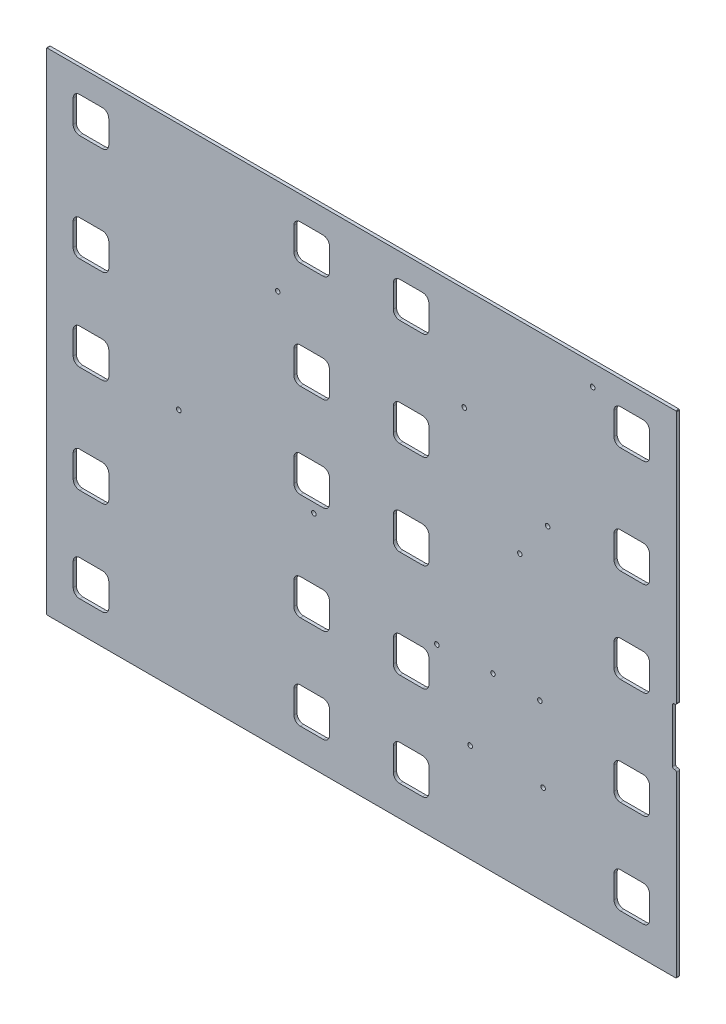
from build123d import *

# Parameters (mm, degrees)
BOSS_EXTRUDE2_DEPTH  = 3.175
CUT_EXTRUDE6_DEPTH   = 570.66370086
LPATTERN2_COUNT      = 2
LPATTERN2_PITCH      = 217.5764
MIRROR1_COPY_1_DEPTH = 570.66370086
CUT_EXTRUDE8_DEPTH   = 570.66370086
FILLET1_R            = 1.5875
M4_CLEARANCE_HOLE1_D = 4.5
FILLET2_R            = 0.79375


with BuildPart() as part:
    # Sketch9 → Boss-Extrude2 (new body)
    with BuildSketch(Plane.XY):
        with BuildLine():
            ThreePointArc((476.883185703, 172.362093322), (476.641026062, 172.560544591), (476.44252393, 172.80266254))
            Line((476.44252393, 172.80266254), (-143.934841652, 172.737505322))
            ThreePointArc((-143.934841652, 172.737505322), (-144.133292922, 172.495345682), (-144.375410871, 172.29684355))
            Line((-144.375410871, 172.29684355), (-144.324643337, -311.072922788))
            ThreePointArc((-144.324643337, -311.072922788), (-144.082483696, -311.271374057), (-143.883981564, -311.513492007))
            Line((-143.883981564, -311.513492007), (476.493384018, -311.448334789))
            ThreePointArc((476.493384018, -311.448334789), (476.691835287, -311.206175148), (476.933953237, -311.007673016))
            Line((476.933953237, -311.007673016), (476.883185703, 172.362093322))
        make_face()
    extrude(amount=BOSS_EXTRUDE2_DEPTH)

    # Sketch10 → Cut-Extrude6 (cut, through all)
    with BuildSketch(Plane.XY.offset(3.175)):
        with BuildLine():
            ThreePointArc((-111.536959772, -153.814293782), (-116.026892468, -155.674637302), (-117.886292807, -160.164960677))
            Line((-117.886292807, -160.164960677), (-117.883937231, -182.592960554))
            ThreePointArc((-117.883937231, -182.592960554), (-116.023593711, -187.08289325), (-111.533270336, -188.942293589))
            Line((-111.533270336, -188.942293589), (-89.105270459, -188.939938012))
            ThreePointArc((-89.105270459, -188.939938012), (-84.615337763, -187.079594493), (-82.755937424, -182.589271117))
            Line((-82.755937424, -182.589271117), (-82.758293, -160.161271241))
            ThreePointArc((-82.758293, -160.161271241), (-84.61863652, -155.671338545), (-89.108959896, -153.811938206))
            Line((-89.108959896, -153.811938206), (-111.536959772, -153.814293782))
        make_face()
        with BuildLine():
            ThreePointArc((-111.527235792, -246.397293273), (-116.017168488, -248.257636793), (-117.876568827, -252.747960168))
            Line((-117.876568827, -252.747960168), (-117.874213251, -275.175960044))
            ThreePointArc((-117.874213251, -275.175960044), (-116.013869731, -279.66589274), (-111.523546356, -281.525293079))
            Line((-111.523546356, -281.525293079), (-89.095546479, -281.522937503))
            ThreePointArc((-89.095546479, -281.522937503), (-84.605613783, -279.662593983), (-82.746213445, -275.172270608))
            Line((-82.746213445, -275.172270608), (-82.748569021, -252.744270731))
            ThreePointArc((-82.748569021, -252.744270731), (-84.608912541, -248.254338035), (-89.099235916, -246.394937697))
            Line((-89.099235916, -246.394937697), (-111.527235792, -246.397293273))
        make_face()
        with BuildLine():
            ThreePointArc((-82.769334556, -55.030671822), (-84.629678076, -50.540739125), (-89.120001451, -48.681338787))
            Line((-89.120001451, -48.681338787), (-111.548001327, -48.683694363))
            ThreePointArc((-111.548001327, -48.683694363), (-116.037934024, -50.544037883), (-117.897334362, -55.034361258))
            Line((-117.897334362, -55.034361258), (-117.894978786, -77.462361134))
            ThreePointArc((-117.894978786, -77.462361134), (-116.034635266, -81.952293831), (-111.544311891, -83.811694169))
            Line((-111.544311891, -83.811694169), (-89.116312015, -83.809338593))
            ThreePointArc((-89.116312015, -83.809338593), (-84.626379318, -81.948995073), (-82.76697898, -77.458671698))
            Line((-82.76697898, -77.458671698), (-82.769334556, -55.030671822))
        make_face()
        with BuildLine():
            ThreePointArc((-89.13707755, 113.904260316), (-84.647144853, 115.764603836), (-82.787744515, 120.254927211))
            Line((-82.787744515, 120.254927211), (-82.790100091, 142.682927088))
            ThreePointArc((-82.790100091, 142.682927088), (-84.650443611, 147.172859784), (-89.140766986, 149.032260122))
            Line((-89.140766986, 149.032260122), (-111.568766862, 149.029904546))
            ThreePointArc((-111.568766862, 149.029904546), (-116.058699559, 147.169561026), (-117.918099897, 142.679237651))
            Line((-117.918099897, 142.679237651), (-117.915744321, 120.251237775))
            ThreePointArc((-117.915744321, 120.251237775), (-116.055400801, 115.761305079), (-111.565077426, 113.90190474))
            Line((-111.565077426, 113.90190474), (-89.13707755, 113.904260316))
        make_face()
        with BuildLine():
            ThreePointArc((-117.904702766, 15.120638356), (-116.044359246, 10.630705659), (-111.554035871, 8.771305321))
            Line((-111.554035871, 8.771305321), (-89.126035994, 8.773660897))
            ThreePointArc((-89.126035994, 8.773660897), (-84.636103298, 10.634004417), (-82.77670296, 15.124327792))
            Line((-82.77670296, 15.124327792), (-82.779058536, 37.552327668))
            ThreePointArc((-82.779058536, 37.552327668), (-84.639402056, 42.042260365), (-89.129725431, 43.901660703))
            Line((-89.129725431, 43.901660703), (-111.557725307, 43.899305127))
            ThreePointArc((-111.557725307, 43.899305127), (-116.047658003, 42.038961607), (-117.907058342, 37.548638232))
            Line((-117.907058342, 37.548638232), (-117.904702766, 15.120638356))
        make_face()
    cut_extrude6 = extrude(amount=-CUT_EXTRUDE6_DEPTH, mode=Mode.SUBTRACT)

    # LPattern2: Cut-Extrude6 ×2
    with Locations(*[Vector(0.9999999944845218, 0.00010502836011310426, 0) * (i * LPATTERN2_PITCH) for i in range(1, LPATTERN2_COUNT)]):
        add(cut_extrude6, mode=Mode.SUBTRACT)

    # Mirror1: Cut-Extrude6 across plane
    add(cut_extrude6.mirror(Plane(origin=(166.271985063, 0.017463274, 0), x_dir=(0, 0, 1), z_dir=(-0.9999999944845219, -0.00010502836011320445, 0))), mode=Mode.SUBTRACT)

    # Mirror1 copy 1 sketch → Mirror1 copy 1 (cut, through all)
    with BuildSketch(Plane(origin=(114.967571327, 0.012074856, 3.175), x_dir=(-0.9999999779380877, -0.00021005671906784565, 0), z_dir=(0, 0, 1))):
        with BuildLine():
            ThreePointArc((-111.536959772, 153.814293782), (-116.026892468, 155.674637302), (-117.886292807, 160.164960677))
            Line((-117.886292807, 160.164960677), (-117.883937231, 182.592960554))
            ThreePointArc((-117.883937231, 182.592960554), (-116.023593711, 187.08289325), (-111.533270336, 188.942293589))
            Line((-111.533270336, 188.942293589), (-89.105270459, 188.939938012))
            ThreePointArc((-89.105270459, 188.939938012), (-84.615337763, 187.079594493), (-82.755937424, 182.589271117))
            Line((-82.755937424, 182.589271117), (-82.758293, 160.161271241))
            ThreePointArc((-82.758293, 160.161271241), (-84.61863652, 155.671338545), (-89.108959896, 153.811938206))
            Line((-89.108959896, 153.811938206), (-111.536959772, 153.814293782))
        make_face()
        with BuildLine():
            ThreePointArc((-111.527235792, 246.397293273), (-116.017168488, 248.257636793), (-117.876568827, 252.747960168))
            Line((-117.876568827, 252.747960168), (-117.874213251, 275.175960044))
            ThreePointArc((-117.874213251, 275.175960044), (-116.013869731, 279.66589274), (-111.523546356, 281.525293079))
            Line((-111.523546356, 281.525293079), (-89.095546479, 281.522937503))
            ThreePointArc((-89.095546479, 281.522937503), (-84.605613783, 279.662593983), (-82.746213445, 275.172270608))
            Line((-82.746213445, 275.172270608), (-82.748569021, 252.744270731))
            ThreePointArc((-82.748569021, 252.744270731), (-84.608912541, 248.254338035), (-89.099235916, 246.394937697))
            Line((-89.099235916, 246.394937697), (-111.527235792, 246.397293273))
        make_face()
        with BuildLine():
            ThreePointArc((-82.769334556, 55.030671822), (-84.629678076, 50.540739125), (-89.120001451, 48.681338787))
            Line((-89.120001451, 48.681338787), (-111.548001327, 48.683694363))
            ThreePointArc((-111.548001327, 48.683694363), (-116.037934024, 50.544037883), (-117.897334362, 55.034361258))
            Line((-117.897334362, 55.034361258), (-117.894978786, 77.462361134))
            ThreePointArc((-117.894978786, 77.462361134), (-116.034635266, 81.952293831), (-111.544311891, 83.811694169))
            Line((-111.544311891, 83.811694169), (-89.116312015, 83.809338593))
            ThreePointArc((-89.116312015, 83.809338593), (-84.626379318, 81.948995073), (-82.76697898, 77.458671698))
            Line((-82.76697898, 77.458671698), (-82.769334556, 55.030671822))
        make_face()
        with BuildLine():
            ThreePointArc((-89.13707755, -113.904260316), (-84.647144853, -115.764603836), (-82.787744515, -120.254927211))
            Line((-82.787744515, -120.254927211), (-82.790100091, -142.682927088))
            ThreePointArc((-82.790100091, -142.682927088), (-84.650443611, -147.172859784), (-89.140766986, -149.032260122))
            Line((-89.140766986, -149.032260122), (-111.568766862, -149.029904546))
            ThreePointArc((-111.568766862, -149.029904546), (-116.058699559, -147.169561026), (-117.918099897, -142.679237651))
            Line((-117.918099897, -142.679237651), (-117.915744321, -120.251237775))
            ThreePointArc((-117.915744321, -120.251237775), (-116.055400801, -115.761305079), (-111.565077426, -113.90190474))
            Line((-111.565077426, -113.90190474), (-89.13707755, -113.904260316))
        make_face()
        with BuildLine():
            ThreePointArc((-117.904702766, -15.120638356), (-116.044359246, -10.630705659), (-111.554035871, -8.771305321))
            Line((-111.554035871, -8.771305321), (-89.126035994, -8.773660897))
            ThreePointArc((-89.126035994, -8.773660897), (-84.636103298, -10.634004417), (-82.77670296, -15.124327792))
            Line((-82.77670296, -15.124327792), (-82.779058536, -37.552327668))
            ThreePointArc((-82.779058536, -37.552327668), (-84.639402056, -42.042260365), (-89.129725431, -43.901660703))
            Line((-89.129725431, -43.901660703), (-111.557725307, -43.899305127))
            ThreePointArc((-111.557725307, -43.899305127), (-116.047658003, -42.038961607), (-117.907058342, -37.548638232))
            Line((-117.907058342, -37.548638232), (-117.904702766, -15.120638356))
        make_face()
    extrude(amount=-MIRROR1_COPY_1_DEPTH, mode=Mode.SUBTRACT)

    # Sketch12 → Cut-Extrude8 (cut, through all)
    with BuildSketch(Plane.XY.offset(3.175)):
        Polygon((476.909497019, -78.154204664), (472.960931489, -78.154204664), (472.960931489, -106.094205498), (472.960931489, -134.034204664), (476.915366003, -134.034204664), align=None)
    extrude(amount=-CUT_EXTRUDE8_DEPTH, mode=Mode.SUBTRACT)

    # Fillet1
    fillet1_edges = [part.edges().sort_by_distance(p)[0] for p in [
        (472.960931489, -78.154204664, 1.5875),
        (472.960931489, -134.034204664, 1.5875),
        (476.909497019, -78.154204664, 1.5875),
        (476.915366003, -134.034204664, 1.5875),
    ]]
    fillet(fillet1_edges, radius=FILLET1_R)

    # M4 Clearance Hole1 (through all)
    with Locations(Plane.XY.offset(3.175)):
        with Locations((-13.737316507, -71.386321592), (119.406061758, -93.07123788), (273.511301069, -214.357153129), (345.511300672, -214.349591087), (240.696463223, -144.493499232), (296.038660132, -141.604786716), (342.238659877, -141.599934406), (322.427523958, -26.052005233), (349.923624735, 11.074864309), (267.691292818, 71.358237181), (394.335307404, 152.15653884), (83.796928701, 78.623923098)):
            Hole(M4_CLEARANCE_HOLE1_D / 2)

    # Fillet2
    fillet2_edges = [part.edges().sort_by_distance(p)[0] for p in [
        (-143.883981564, -311.513492007, 1.5875),
        (-144.324643337, -311.072922788, 1.5875),
        (476.493384018, -311.448334789, 1.5875),
        (476.933953237, -311.007673016, 1.5875),
        (476.883185703, 172.362093322, 1.5875),
        (476.44252393, 172.80266254, 1.5875),
        (-143.934841652, 172.737505322, 1.5875),
        (-144.375410871, 172.29684355, 1.5875),
    ]]
    fillet(fillet2_edges, radius=FILLET2_R)


solid = part.part
